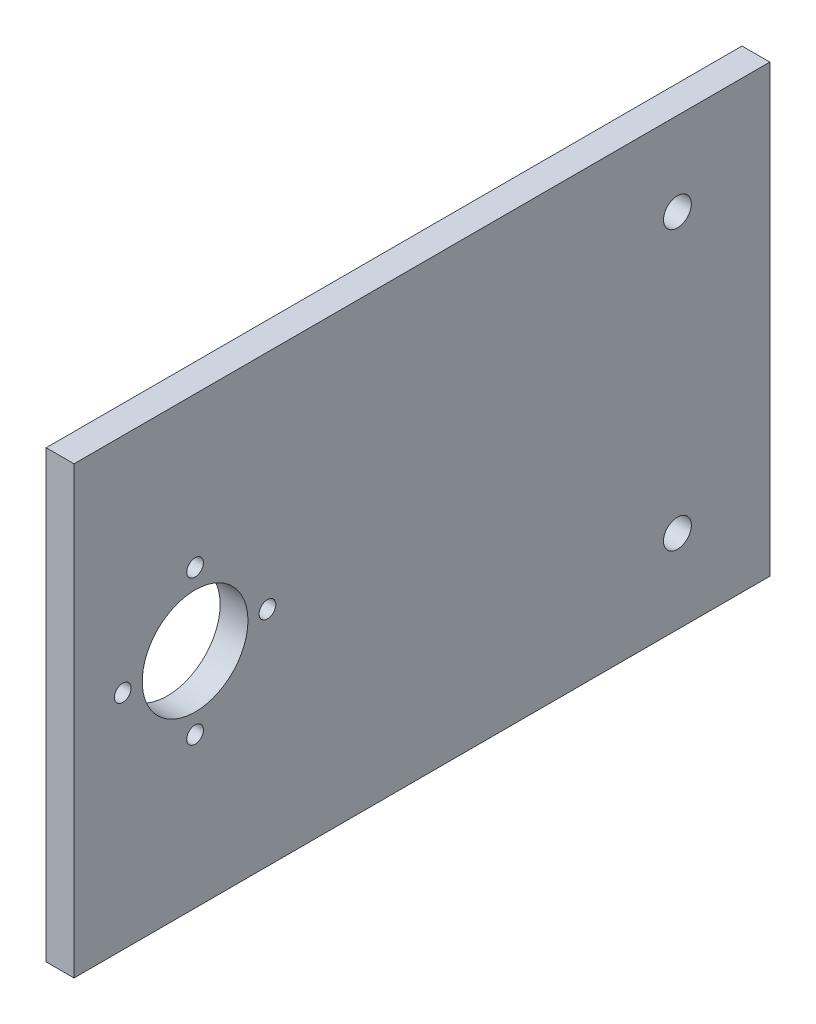
from build123d import *

# Parameters (mm, degrees)
SKETCH1_W           = 80
SKETCH1_H           = 125
SKETCH1_R           = 1.5
SKETCH1_R_2         = 9.5
SKETCH1_R_3         = 2.5
BOSS_EXTRUDE1_DEPTH = 5


with BuildPart() as part:
    # Sketch1 → Boss-Extrude1 (new body)
    with BuildSketch(Plane.YZ):
        Rectangle(SKETCH1_W, SKETCH1_H)
        with Locations((0, 53.75)):
            Circle(SKETCH1_R, mode=Mode.SUBTRACT)
        with Locations((0, 27.75)):
            Circle(SKETCH1_R, mode=Mode.SUBTRACT)
        with Locations((-13, 40.75)):
            Circle(SKETCH1_R, mode=Mode.SUBTRACT)
        with Locations((13, 40.75)):
            Circle(SKETCH1_R, mode=Mode.SUBTRACT)
        with Locations((0, 40.75)):
            Circle(SKETCH1_R_2, mode=Mode.SUBTRACT)
        with Locations((-25, -45.9)):
            Circle(SKETCH1_R_3, mode=Mode.SUBTRACT)
        with Locations((25, -45.9)):
            Circle(SKETCH1_R_3, mode=Mode.SUBTRACT)
    extrude(amount=BOSS_EXTRUDE1_DEPTH)


solid = part.part
